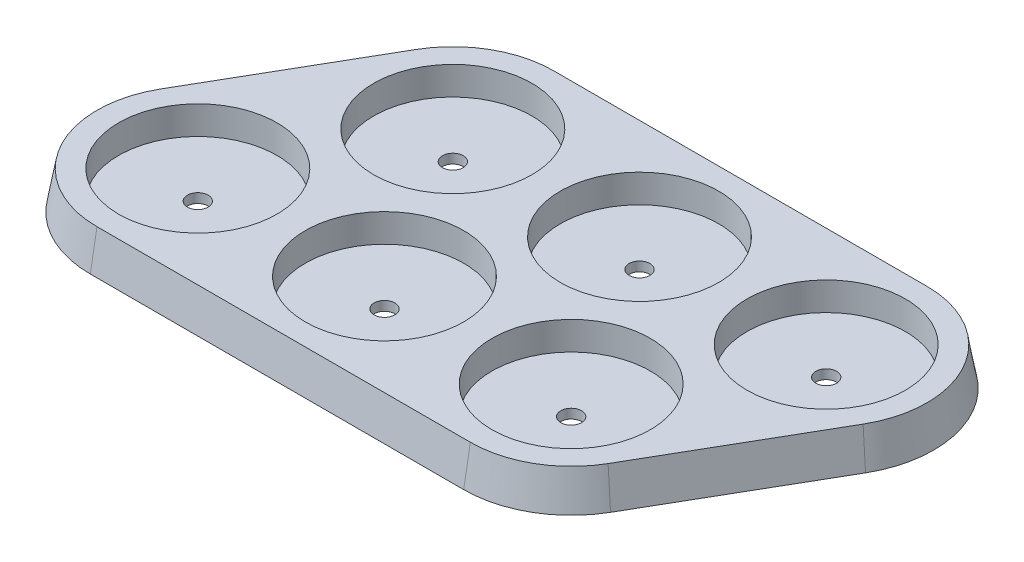
from build123d import *

# Parameters (mm, degrees)
BOSS_EXTRUDE1_DEPTH = 4
BOSS_EXTRUDE1_DRAFT = 10
CUT_EXTRUDE1_START  = 4
SKETCH1_3_R         = 1.1
CUT_EXTRUDE1_DEPTH  = 4
CUT_EXTRUDE2_START  = 4
SKETCH1_4_R         = 8.4
SKETCH1_4_R_2       = 1.1
CUT_EXTRUDE2_DEPTH  = 3


# Read off the part's stored shape, not the designer's step: Boss-Extrude1
with BuildPart() as part:
    # Boss-Extrude1 outline → Boss-Extrude1 (with draft: the straight prism first)
    with BuildSketch(Plane(origin=(0, 4, 0), x_dir=(1, 0, 0), z_dir=(0, 1, 0))):
        with BuildLine():
            ThreePointArc((-58.761875024, -11.799956956), (-58.761875024, -22.494649034), (-49.5, -27.841995072))
            Line((-49.5, -27.841995072), (-9.9, -27.841995072))
            ThreePointArc((-9.9, -27.841995072), (-4.552653961, -26.409178019), (-0.638124976, -22.494649034))
            Line((-0.638124976, -22.494649034), (9.261875024, -5.347346039))
            ThreePointArc((9.261875024, -5.347346039), (9.261875024, 5.347346039), (0, 10.694692077))
            Line((0, 10.694692077), (-39.6, 10.694692077))
            ThreePointArc((-39.6, 10.694692077), (-44.947346039, 9.261875024), (-48.861875024, 5.347346039))
            Line((-48.861875024, 5.347346039), (-58.761875024, -11.799956956))
        make_face()
    extrude(amount=-BOSS_EXTRUDE1_DEPTH)
    # Boss-Extrude1: the draft: its side faces are tilted about the plane it starts from
    boss_extrude1_sides = [part.faces().sort_by_distance(p)[0] for p in [
        (-53.811875024, 2, 3.226305459),
        (-58.761875024, 2, 22.494649033),
        (-29.7, 2, 27.841995072),
        (-4.552653962, 2, 26.409178019),
        (4.311875024, 2, 13.920997536),
        (9.261875024, 2, -5.347346038),
        (-19.8, 2, -10.694692077),
        (-44.947346038, 2, -9.261875024),
    ]]
    draft(boss_extrude1_sides, Plane(origin=(0, 4, 0), x_dir=(1, 0, 0), z_dir=(0, 1, 0)), BOSS_EXTRUDE1_DRAFT)

    # Sketch1<3> → Cut-Extrude1 (cut)
    with BuildSketch(Plane(origin=(0, 0, 0), x_dir=(1, 0, 0), z_dir=(0, 1, 0)).offset(CUT_EXTRUDE1_START)):
        with Locations(Location((-9.9, -17.147302995, 0), (0, 0, 270))):
            Circle(SKETCH1_3_R)
        with Locations(Location((0, 0, 0), (0, 0, 270))):
            Circle(SKETCH1_3_R)
        with Locations(Location((-29.7, -17.147302995, 0), (0, 0, 270))):
            Circle(SKETCH1_3_R)
        with Locations(Location((-39.6, 0, 0), (0, 0, 270))):
            Circle(SKETCH1_3_R)
        with Locations(Location((-49.5, -17.147302995, 0), (0, 0, 270))):
            Circle(SKETCH1_3_R)
        with Locations(Location((-19.8, 0, 0), (0, 0, 270))):
            Circle(SKETCH1_3_R)
    extrude(amount=-CUT_EXTRUDE1_DEPTH, mode=Mode.SUBTRACT)

    # Sketch1<4> → Cut-Extrude2 (cut)
    # profile 1 of 6: a face of its own
    with BuildSketch(Plane(origin=(0, 0, 0), x_dir=(1, 0, 0), z_dir=(0, 1, 0)).offset(CUT_EXTRUDE2_START)):
        with Locations(Location((-19.8, 0, 0), (0, 0, 270))):
            Circle(SKETCH1_4_R)
        with Locations(Location((-19.8, 0, 0), (0, 0, 270))):
            Circle(SKETCH1_4_R_2, mode=Mode.SUBTRACT)
    # profile 2 of 6: a face of its own
    with BuildSketch(Plane(origin=(0, 0, 0), x_dir=(1, 0, 0), z_dir=(0, 1, 0)).offset(CUT_EXTRUDE2_START)):
        with Locations(Location((-9.9, -17.147302995, 0), (0, 0, 270))):
            Circle(SKETCH1_4_R)
        with Locations(Location((-9.9, -17.147302995, 0), (0, 0, 270))):
            Circle(SKETCH1_4_R_2, mode=Mode.SUBTRACT)
    # profile 3 of 6: a face of its own
    with BuildSketch(Plane(origin=(0, 0, 0), x_dir=(1, 0, 0), z_dir=(0, 1, 0)).offset(CUT_EXTRUDE2_START)):
        with Locations(Location((0, 0, 0), (0, 0, 270))):
            Circle(SKETCH1_4_R)
        with Locations(Location((0, 0, 0), (0, 0, 270))):
            Circle(SKETCH1_4_R_2, mode=Mode.SUBTRACT)
    # profile 4 of 6: a face of its own
    with BuildSketch(Plane(origin=(0, 0, 0), x_dir=(1, 0, 0), z_dir=(0, 1, 0)).offset(CUT_EXTRUDE2_START)):
        with Locations(Location((-29.7, -17.147302995, 0), (0, 0, 270))):
            Circle(SKETCH1_4_R)
        with Locations(Location((-29.7, -17.147302995, 0), (0, 0, 270))):
            Circle(SKETCH1_4_R_2, mode=Mode.SUBTRACT)
    # profile 5 of 6: a face of its own
    with BuildSketch(Plane(origin=(0, 0, 0), x_dir=(1, 0, 0), z_dir=(0, 1, 0)).offset(CUT_EXTRUDE2_START)):
        with Locations(Location((-39.6, 0, 0), (0, 0, 270))):
            Circle(SKETCH1_4_R)
        with Locations(Location((-39.6, 0, 0), (0, 0, 270))):
            Circle(SKETCH1_4_R_2, mode=Mode.SUBTRACT)
    # profile 6 of 6: a face of its own
    with BuildSketch(Plane(origin=(0, 0, 0), x_dir=(1, 0, 0), z_dir=(0, 1, 0)).offset(CUT_EXTRUDE2_START)):
        with Locations(Location((-49.5, -17.147302995, 0), (0, 0, 270))):
            Circle(SKETCH1_4_R)
        with Locations(Location((-49.5, -17.147302995, 0), (0, 0, 270))):
            Circle(SKETCH1_4_R_2, mode=Mode.SUBTRACT)
    extrude(amount=-CUT_EXTRUDE2_DEPTH, mode=Mode.SUBTRACT)


solid = part.part
